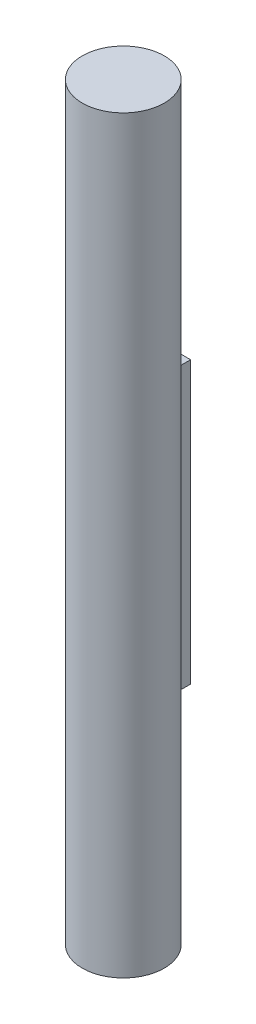
from build123d import *

# Parameters (mm, degrees)
BOSS_EXTRUDE2_DEPTH = 101.6
BOSS_EXTRUDE3_DEPTH = 38.1
MOVE_FACE4_DEPTH    = 27.214285714
MOVE_START          = 38.1
MOVE_FACE4_2_DEPTH  = 27.214285714


# Read off the part's stored shape, not the designer's step: Move Face4
with BuildPart() as part:
    # Sketch2 → Boss-Extrude2 (new body)
    with BuildSketch(Plane(origin=(0, 0, 0), x_dir=(1, 0, 0), z_dir=(0, 1, 0))):
        with BuildLine():
            Line((-1.190625, -5.427184), (-1.190625, 5.427184))
            ThreePointArc((-1.190625, 5.427184), (-5.55625, 0), (-1.190625, -5.427184))
        make_face()
        with BuildLine():
            ThreePointArc((1.190625, 5.427184), (0, 5.55625), (-1.190625, 5.427184))
            Line((-1.190625, 5.427184), (-1.190625, -5.427184))
            ThreePointArc((-1.190625, -5.427184), (0, -5.55625), (1.190625, -5.427184))
            Line((1.190625, -5.427184), (1.190625, 5.427184))
        make_face()
        with BuildLine():
            ThreePointArc((5.55625, 0), (4.32939512, 3.482563991), (1.190625, 5.427184))
            Line((1.190625, 5.427184), (1.190625, -5.427184))
            ThreePointArc((1.190625, -5.427184), (4.32939512, -3.482563991), (5.55625, 0))
        make_face()
    extrude(amount=BOSS_EXTRUDE2_DEPTH)


with BuildPart() as body_2:
    # Sketch2<4> → Boss-Extrude3 (new body)
    with BuildSketch(Plane(origin=(0, 0, 0), x_dir=(1, 0, 0), z_dir=(0, 1, 0))):
        with BuildLine():
            Line((1.190625, 7.9375), (-1.190625, 7.9375))
            Line((-1.190625, 7.9375), (-1.190625, 5.427184))
            ThreePointArc((-1.190625, 5.427184), (0, 5.55625), (1.190625, 5.427184))
            Line((1.190625, 5.427184), (1.190625, 7.9375))
        make_face()
    extrude(amount=BOSS_EXTRUDE3_DEPTH)

    # Move Face4 outline → Move Face4 (cut)
    with BuildSketch(Plane(origin=(0, 0, 0), x_dir=(1, 0, 0), z_dir=(0, 1, 0))):
        with BuildLine():
            Line((-1.190625, 7.9375), (-1.190625, 5.427184))
            ThreePointArc((-1.190625, 5.427184), (0, 5.55625), (1.190625, 5.427184))
            Line((1.190625, 5.427184), (1.190625, 7.9375))
            Line((1.190625, 7.9375), (-1.190625, 7.9375))
        make_face()
    extrude(amount=MOVE_FACE4_DEPTH, mode=Mode.SUBTRACT)

    # Move Face4 2 outline → Move Face4 2 (add)
    with BuildSketch(Plane(origin=(0, 0, 0), x_dir=(1, 0, 0), z_dir=(0, 1, 0)).offset(MOVE_START)):
        with BuildLine():
            Line((-1.190625, 7.9375), (-1.190625, 5.427184))
            ThreePointArc((-1.190625, 5.427184), (0, 5.55625), (1.190625, 5.427184))
            Line((1.190625, 5.427184), (1.190625, 7.9375))
            Line((1.190625, 7.9375), (-1.190625, 7.9375))
        make_face()
    extrude(amount=MOVE_FACE4_2_DEPTH)


solid = Compound([part.part, body_2.part])
